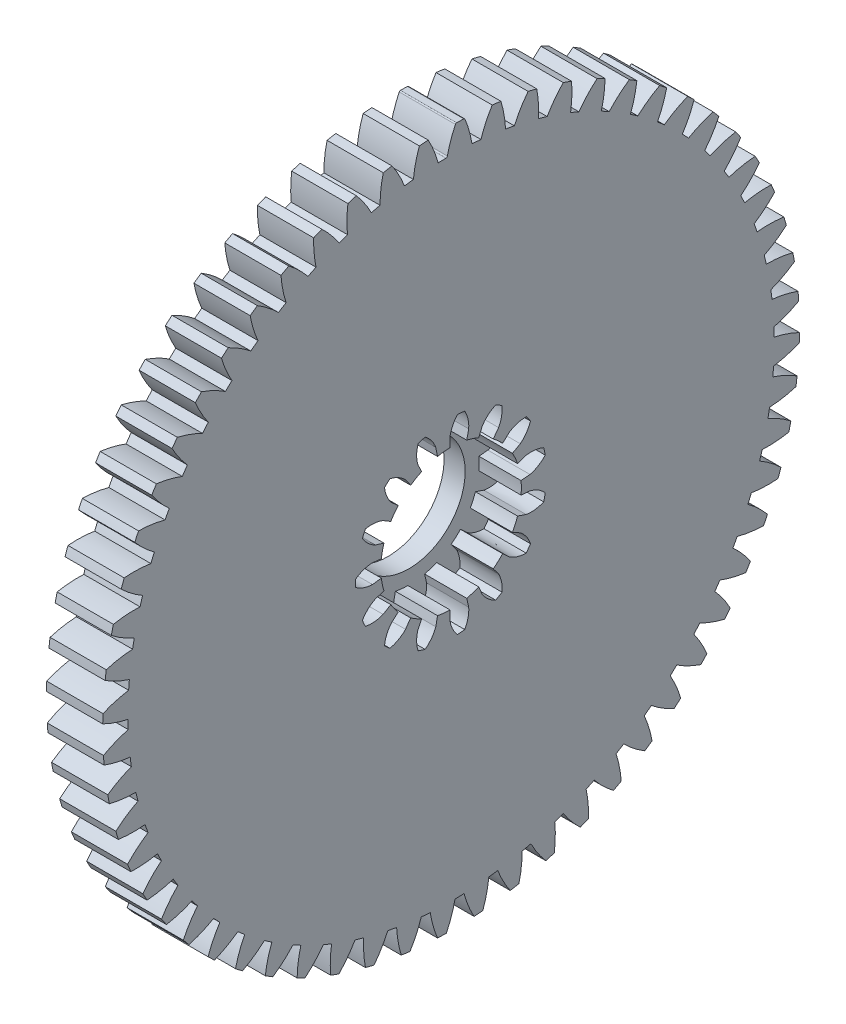
from build123d import *

# Parameters (mm, degrees)
SKETCH_1_R                  = 23
EXTRUDE_1_DEPTH             = 4
SKETCH_4_R                  = 5
EXTRUDE_3_DEPTH             = 0.5
FILLET_2_R                  = 0.5
EXTRUDE_5_REACH             = 34.623
EXTRUDE_5_DIRECTION_2_REACH = 34.623
SKETCH_10_R                 = 5
CUT_EXTRUDE_2_DEPTH         = 3
FILLET_3_R                  = 0.1
SKETCH_5_R                  = 4
CUT_EXTRUDE_1_DEPTH         = 35.119370777
CUT_EXTRUDE_3_DEPTH         = 3
PATTERN_CIRCULAR_1_COUNT    = 15
PATTERN_CIRCULAR_2_COUNT    = 60


with BuildPart() as part:
    # Эскиз1 → Бобышка-Вытянуть1 (new body)
    with BuildSketch(Plane(origin=(0, 0, 0), x_dir=(0, 0, -1), z_dir=(1, 0, 0))):
        Circle(SKETCH_1_R)
    extrude(amount=EXTRUDE_1_DEPTH)

    # Эскиз4 → Бобышка-Вытянуть3 (add)
    with BuildSketch(Plane.ZY):
        Circle(SKETCH_4_R)
    extrude(amount=EXTRUDE_3_DEPTH)

    # Скругление2
    fillet_2_edges = [part.edges().sort_by_distance(p)[0] for p in [
        (0, 0, -5),
    ]]
    fillet(fillet_2_edges, radius=FILLET_2_R - 0.0001)  # a hair under: the kernel refuses the full size

    # Бобышка-Вытянуть5: up to this face of the body (flat: up to its plane)
    extrude_5_end = Plane(part.part.faces().sort_by_distance((4, 0, 0))[0])
    # Эскиз8 → Бобышка-Вытянуть5 (add, up to the picked face)
    with BuildSketch(Plane(origin=(2, 0, 0), x_dir=(0, 0, -1), z_dir=(1, 0, 0)), mode=Mode.PRIVATE) as extrude_5_sk1:
        with BuildLine():
            ThreePointArc((0.963284859, 24.78128492), (0.649188318, 24.791501659), (0.334987533, 24.797737464))
            add(Edge.make_bspline(
                [(-0.282742088, 22.998262041), (-0.083985313, 23.936494769), (0.334987533, 24.797737464)],
                knots=[0, 0, 0, 1, 1, 1], degree=2))
            ThreePointArc((-0.282742088, 22.998262041), (0.602069811, 22.992118474), (1.485990636, 22.951946145))
            add(Edge.make_bspline(
                [(1.485990636, 22.951946145), (1.336609557, 23.899295183), (0.963284859, 24.78128492)],
                knots=[0, 0, 0, 1, 1, 1], degree=2))
        make_face()
    extrude_5_tool1 = split(extrude(extrude_5_sk1.sketch, amount=EXTRUDE_5_REACH, mode=Mode.PRIVATE), bisect_by=extrude_5_end, keep=Keep.BOTH, mode=Mode.PRIVATE)
    extrude_5 = extrude_5_tool1.solids().sort_by(Axis((2, 23.755097, -0.622049), (1, 0, 0)))[0]
    add(extrude_5)

    # Бобышка-Вытянуть5 direction 2: up to this face of the body (flat: up to its plane)
    extrude_5_direction_2_end = Plane(part.part.faces().sort_by_distance((0, 0, -6.150438239))[0])
    # Эскиз8 → Бобышка-Вытянуть5 direction 2 (add, up to the picked face)
    with BuildSketch(Plane(origin=(2, 0, 0), x_dir=(0, 0, -1), z_dir=(1, 0, 0)), mode=Mode.PRIVATE) as extrude_5_direction_2_sk1:
        with BuildLine():
            ThreePointArc((0.963284859, 24.78128492), (0.649188318, 24.791501659), (0.334987533, 24.797737464))
            add(Edge.make_bspline(
                [(-0.282742088, 22.998262041), (-0.083985313, 23.936494769), (0.334987533, 24.797737464)],
                knots=[0, 0, 0, 1, 1, 1], degree=2))
            ThreePointArc((-0.282742088, 22.998262041), (0.602069811, 22.992118474), (1.485990636, 22.951946145))
            add(Edge.make_bspline(
                [(1.485990636, 22.951946145), (1.336609557, 23.899295183), (0.963284859, 24.78128492)],
                knots=[0, 0, 0, 1, 1, 1], degree=2))
        make_face()
    extrude_5_direction_2_tool1 = split(extrude(extrude_5_direction_2_sk1.sketch, amount=-EXTRUDE_5_DIRECTION_2_REACH, mode=Mode.PRIVATE), bisect_by=extrude_5_direction_2_end, keep=Keep.BOTH, mode=Mode.PRIVATE)
    extrude_5_direction_2 = extrude_5_direction_2_tool1.solids().sort_by(Axis((2, 23.755097, -0.622049), (-1, 0, 0)))[0]
    add(extrude_5_direction_2)

    # Эскиз10 → Вырез-Вытянуть2 (cut)
    with BuildSketch(Plane(origin=(4, 0, 0), x_dir=(0, 0, -1), z_dir=(1, 0, 0))):
        Circle(SKETCH_10_R)
    extrude(amount=-CUT_EXTRUDE_2_DEPTH, mode=Mode.SUBTRACT)

    # Скругление3
    fillet_3_edges = [part.edges().sort_by_distance(p)[0] for p in [
        (3, 22.998262041, 0.282742088),
        (3, 22.951946145, -1.485990636),
        (1, 24.797737464, -0.334987533),
        (1, 24.78128492, -0.963284859),
    ]]
    fillet(fillet_3_edges, radius=FILLET_3_R)

    # Эскиз5 → Вырез-Вытянуть1 (cut, through all)
    with BuildSketch(Plane.ZY.offset(0.5)):
        Circle(SKETCH_5_R)
    extrude(amount=-CUT_EXTRUDE_1_DEPTH, mode=Mode.SUBTRACT)

    # Эскиз9 → Вырез-Вытянуть3 (cut)
    with BuildSketch(Plane(origin=(4, 0, 0), x_dir=(0, 0, -1), z_dir=(1, 0, 0))):
        with BuildLine():
            Line((-0.084030126, 5.637529504), (-0.07451916, 4.999444659))
            ThreePointArc((-0.07451916, 4.999444659), (0.522642316, 4.972609477), (1.11233373, 4.874701393))
            Line((1.11233373, 4.874701393), (1.254302158, 5.496865113))
            add(Edge.make_bspline(
                [(1.254302158, 5.496865113), (1.295961503, 6.143933553), (0.971317611, 6.730270581)],
                knots=[0, 0, 0, 1, 1, 1], degree=2))
            ThreePointArc((0.971317611, 6.730270581), (0.71079355, 6.762748889), (0.449209945, 6.785146308))
            add(Edge.make_bspline(
                [(-0.084030126, 5.637529504), (0.009753979, 6.279119411), (0.449209945, 6.785146308)],
                knots=[0, 0, 0, 1, 1, 1], degree=2))
        make_face()
    cut_extrude_3 = extrude(amount=-CUT_EXTRUDE_3_DEPTH, mode=Mode.SUBTRACT)

    # Круговой массив1: Вырез-Вытянуть3 ×15 about axis
    pattern_circular_1_axis = Axis((1, 0, 0), (1, 0, 0))
    for i in range(1, PATTERN_CIRCULAR_1_COUNT):
        add(cut_extrude_3.rotate(pattern_circular_1_axis, i * 360 / PATTERN_CIRCULAR_1_COUNT), mode=Mode.SUBTRACT)

    # Круговой массив2: Бобышка-Вытянуть5, Бобышка-Вытянуть5 direction 2 ×60 about axis
    pattern_circular_2_axis = Axis((4, 0, 0), (-1, 0, 0))
    add([extrude_5.rotate(pattern_circular_2_axis, i * 360 / PATTERN_CIRCULAR_2_COUNT) for i in range(1, PATTERN_CIRCULAR_2_COUNT)])
    add([extrude_5_direction_2.rotate(pattern_circular_2_axis, i * 360 / PATTERN_CIRCULAR_2_COUNT) for i in range(1, PATTERN_CIRCULAR_2_COUNT)])


solid = part.part
